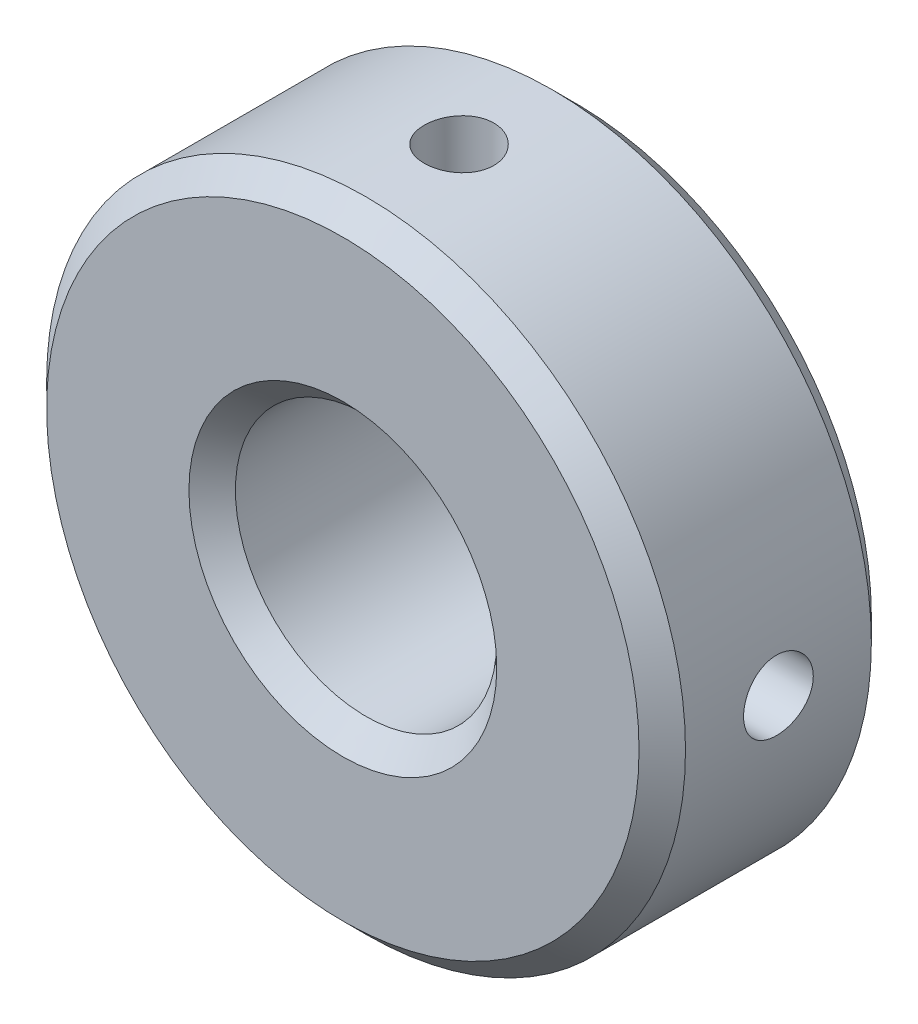
from build123d import *

# Parameters (mm, degrees)
SKETCH1_R         = 11
SKETCH1_R_2       = 4.5
BASENUT_DEPTH     = 4
CIRPATTERN1_COUNT = 4
CHAMFER1_SIZE     = 0.8


with BuildPart() as part:
    # Sketch1 → BaseNut (new, symmetric)
    with BuildSketch(Plane.XY):
        Circle(SKETCH1_R)
        Circle(SKETCH1_R_2, mode=Mode.SUBTRACT)
    extrude(amount=BASENUT_DEPTH, both=True)

    # Sketch2 → Cut-Revolve2 (revolve, cut)
    with BuildSketch(Plane.XY):
        Polygon((0, 11), (1.2001011, 11), (1.2001011, 7.61054178), (0, 6.917663087), align=None)
    cut_revolve2 = revolve(axis=Axis((0, 14.609026702, 0), (0, -1, 0)), mode=Mode.SUBTRACT)

    # CirPattern1: Cut-Revolve2 ×4 about axis
    cirpattern1_axis = Axis((0, 0, -4), (0, 0, 1))
    for i in range(1, CIRPATTERN1_COUNT):
        add(cut_revolve2.rotate(cirpattern1_axis, i * 360 / CIRPATTERN1_COUNT), mode=Mode.SUBTRACT)

    # Chamfer1
    chamfer1_edges = [part.edges().sort_by_distance(p)[0] for p in [
        (-4.5, 0, -4),
        (-11, 0, -4),
        (-4.5, 0, 4),
        (-11, 0, 4),
    ]]
    chamfer(chamfer1_edges, length=CHAMFER1_SIZE)


solid = part.part
